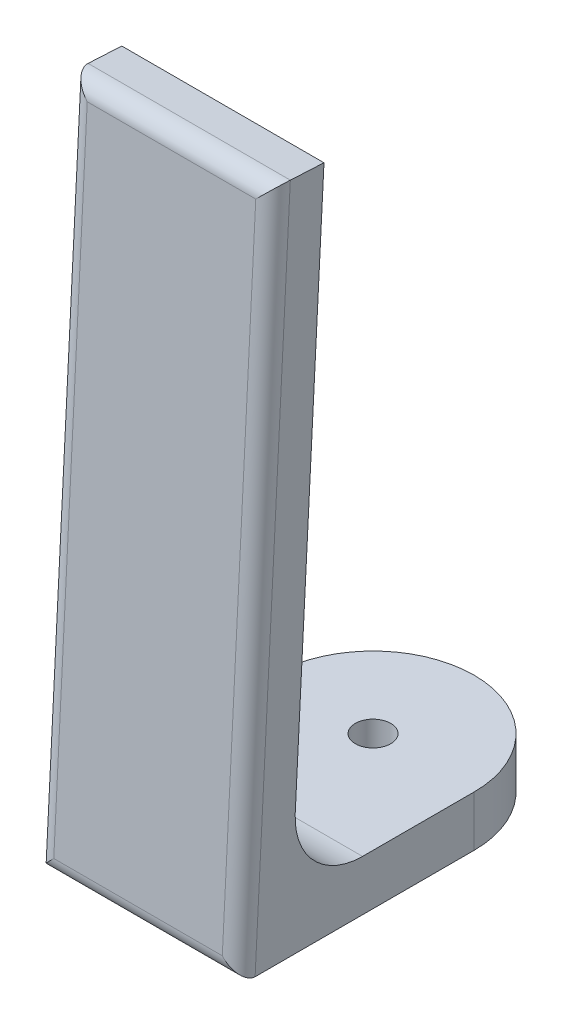
from build123d import *

# Parameters (mm, degrees)
EXTRUDE_1_DEPTH     = 12
SKETCH_2_R          = 1.05
CUT_EXTRUDE_1_DEPTH = 12
FILLET_1_R          = 1
FILLET_2_R          = 6
FILLET_3_R          = 4


with BuildPart() as part:
    # 草图1 → 凸台-拉伸1 (new body)
    with BuildSketch(Plane(origin=(0, 0, 0), x_dir=(0, 0, -1), z_dir=(1, 0, 0))):
        Polygon((2.09343825, 39.94518139), (0, 0), (20, 0), (20, 3), (3.161340376, 3), (5.089326854, 39.788173521), align=None)
    extrude(amount=EXTRUDE_1_DEPTH)

    # 草图2 → 切除-拉伸1 (cut)
    with BuildSketch(Plane(origin=(0, 3, 0), x_dir=(1, 0, 0), z_dir=(0, 1, 0))):
        with Locations(Location((6, 14, 0), (0, 0, 270))):
            Circle(SKETCH_2_R)
    extrude(amount=-CUT_EXTRUDE_1_DEPTH, mode=Mode.SUBTRACT)

    # 圆角1
    fillet_1_edges = [part.edges().sort_by_distance(p)[0] for p in [
        (6, 0, 0),
        (6, 39.94518139, -2.09343825),
        (0, 19.972590695, -1.046719125),
        (12, 19.972590695, -1.046719125),
    ]]
    fillet(fillet_1_edges, radius=FILLET_1_R)

    # 圆角2
    fillet_2_edges = [part.edges().sort_by_distance(p)[0] for p in [
        (0, 1.5, -20),
        (12, 1.5, -20),
    ]]
    fillet(fillet_2_edges, radius=FILLET_2_R - 0.0001)  # a hair under: the kernel refuses the full size

    # 圆角3
    fillet_3_edges = [part.edges().sort_by_distance(p)[0] for p in [
        (6, 3, -3.161340376),
    ]]
    fillet(fillet_3_edges, radius=FILLET_3_R)


solid = part.part
